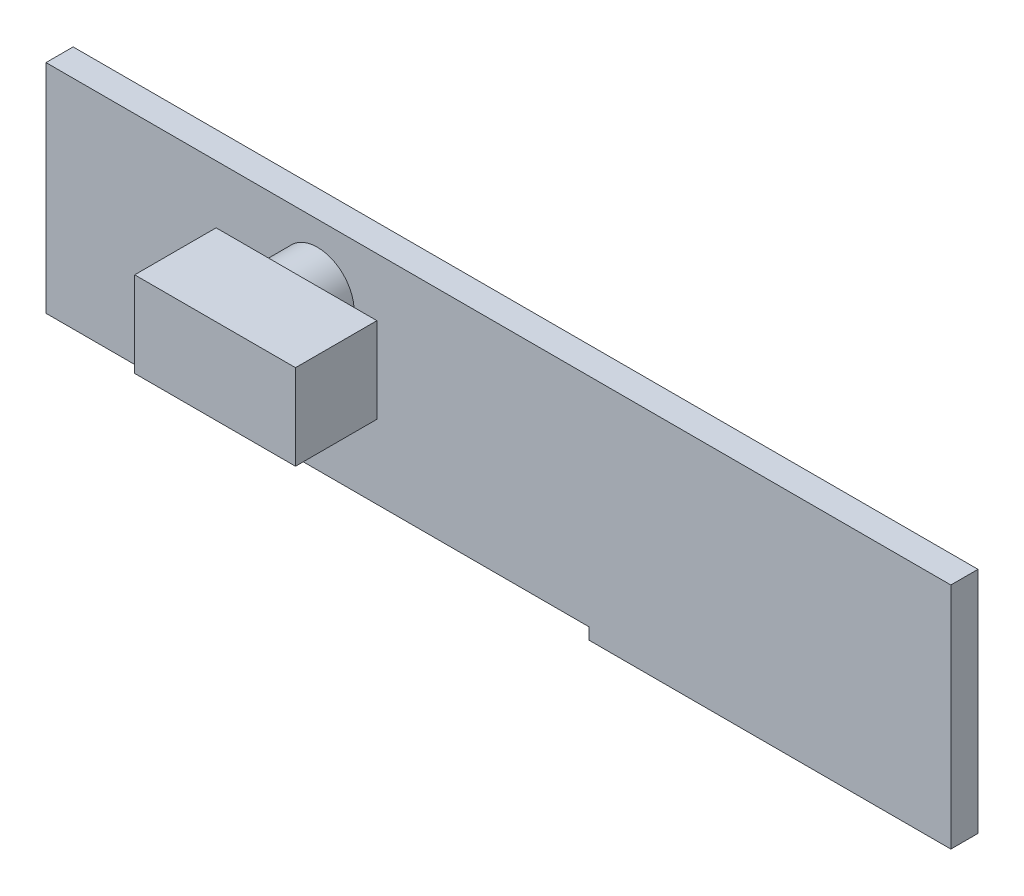
from build123d import *

# Parameters (mm, degrees)
SKETCH2_W           = 254
SKETCH2_H           = 12.7
BOSS_EXTRUDE1_DEPTH = 101.6
SKETCH3_R           = 17.140791438
BOSS_EXTRUDE2_DEPTH = 19.05
SKETCH4_W           = 75.235944222
SKETCH4_H           = 39.955088207
BOSS_EXTRUDE3_DEPTH = 38.1
SCALE2_SCALE        = 0.00375
ROTATE_ANGLE        = 90
SKETCH6_W           = 0.635
SKETCH6_H           = 0.047625
BOSS_EXTRUDE6_DEPTH = 0.40132


with BuildPart() as part:
    # Sketch2 → Boss-Extrude1 (new body)
    with BuildSketch(Plane.XY):
        with Locations((79.130769231, 14.898076923)):
            Rectangle(SKETCH2_W, SKETCH2_H)
    extrude(amount=BOSS_EXTRUDE1_DEPTH)

    # Sketch3 → Boss-Extrude2 (add)
    with BuildSketch(Plane(origin=(0, 21.248076923, 0), x_dir=(1, 0, 0), z_dir=(0, 1, 0))):
        with Locations((79.130769231, -28.483063876)):
            Circle(SKETCH3_R)
    extrude(amount=BOSS_EXTRUDE2_DEPTH)

    # Sketch4 → Boss-Extrude3 (add)
    with BuildSketch(Plane(origin=(0, 40.298076923, 0), x_dir=(1, 0, 0), z_dir=(0, 1, 0))):
        with Locations((88.38546847, -28.088530296)):
            Rectangle(SKETCH4_W, SKETCH4_H)
    extrude(amount=BOSS_EXTRUDE3_DEPTH)


with BuildPart() as part_1:
    # Scale2: scaled about (81.435728249, 26.575729378, 44.290186425)
    add(part.part.scale(SCALE2_SCALE).moved(Location((81.130344268, 26.476070393, 44.124098226))))


with BuildPart() as part_2:
    # rotate: moved
    add(part_1.part.rotate(Axis((0, 33.666927966, 26.550068274), (1, 0, 0)), ROTATE_ANGLE))


with BuildPart() as part_3:
    # Move Body 4 x: moved
    add(part_2.part.moved(Location((-101.6, 0, 0))))


with BuildPart() as part_4:
    # Move Body 2 y: moved
    add(part_3.part.moved(Location((0, -55.88, 0))))


with BuildPart() as part_5:
    # Move Body 2.1z: moved
    add(part_4.part.moved(Location((0, 0, -30.48))))

    # Sketch6 → Boss-Extrude6 (add)
    with BuildSketch(Plane(origin=(0, -39.787101985, 0), x_dir=(1, 0, 0), z_dir=(0, 1, 0))):
        with Locations((-19.379165348, 11.064921511)):
            Rectangle(SKETCH6_W, SKETCH6_H)
    extrude(amount=-BOSS_EXTRUDE6_DEPTH)


solid = part_5.part
